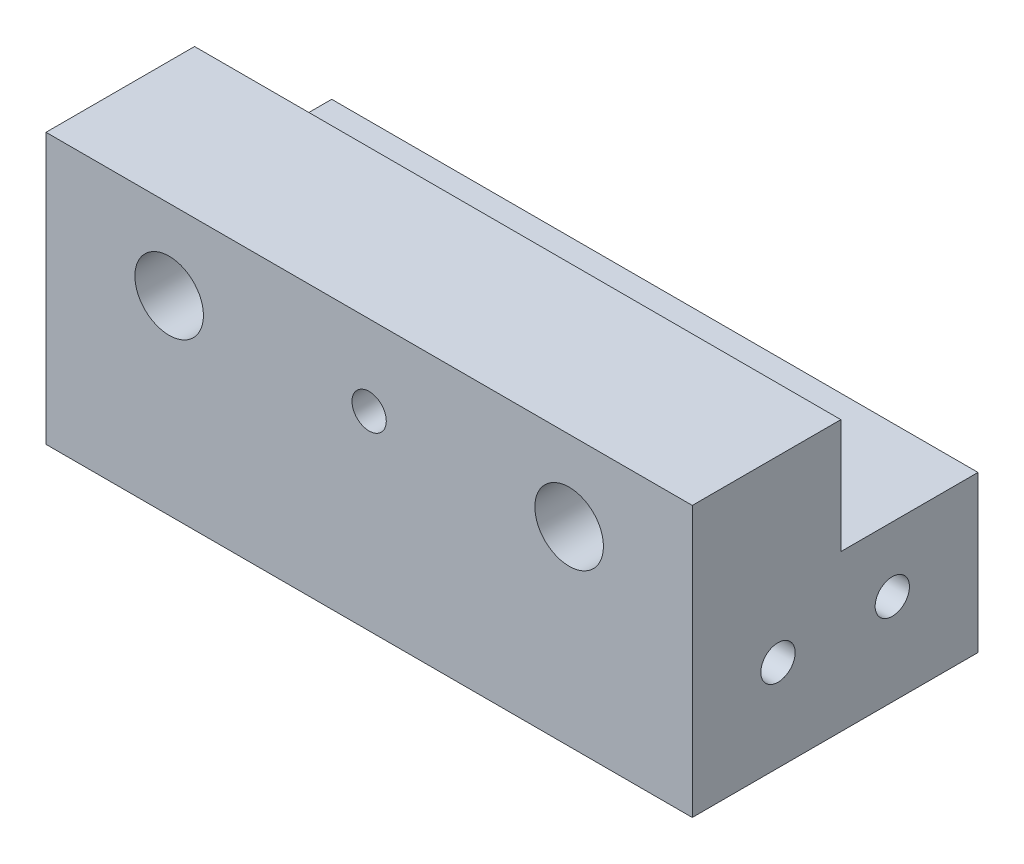
from build123d import *

# Parameters (mm, degrees)
SKETCH1_W           = 56.55
SKETCH1_H           = 23.65
BOSS_EXTRUDE1_DEPTH = 25
SKETCH2_R           = 3
SKETCH2_R_2         = 1.5
CUT_EXTRUDE1_DEPTH  = 10
SKETCH3_R           = 1.5
CUT_EXTRUDE2_DEPTH  = 63.950243248
SKETCH4_W           = 12
SKETCH4_H           = 10
CUT_EXTRUDE3_DEPTH  = 63.950243248


with BuildPart() as part:
    # Sketch1 → Boss-Extrude1 (new body)
    with BuildSketch(Plane.XY):
        Rectangle(SKETCH1_W, SKETCH1_H)
    extrude(amount=BOSS_EXTRUDE1_DEPTH)

    # Sketch2 → Cut-Extrude1 (cut)
    with BuildSketch(Plane.XY.offset(25)):
        with Locations((17.5, 4.825)):
            Circle(SKETCH2_R)
        with Locations((-17.5, 4.825)):
            Circle(SKETCH2_R)
        with Locations((0, 4.825)):
            Circle(SKETCH2_R_2)
    extrude(amount=-CUT_EXTRUDE1_DEPTH, mode=Mode.SUBTRACT)

    # Sketch3 → Cut-Extrude2 (cut, through all)
    with BuildSketch(Plane.ZY.offset(28.275)):
        with Locations((17.5, -3.8250001)):
            Circle(SKETCH3_R)
        with Locations((7.5, -3.8250001)):
            Circle(SKETCH3_R)
    extrude(amount=-CUT_EXTRUDE2_DEPTH, mode=Mode.SUBTRACT)

    # Sketch4 → Cut-Extrude3 (cut, through all)
    with BuildSketch(Plane.ZY.offset(28.275)):
        with Locations((6, 6.825)):
            Rectangle(SKETCH4_W, SKETCH4_H)
    extrude(amount=-CUT_EXTRUDE3_DEPTH, mode=Mode.SUBTRACT)


solid = part.part
